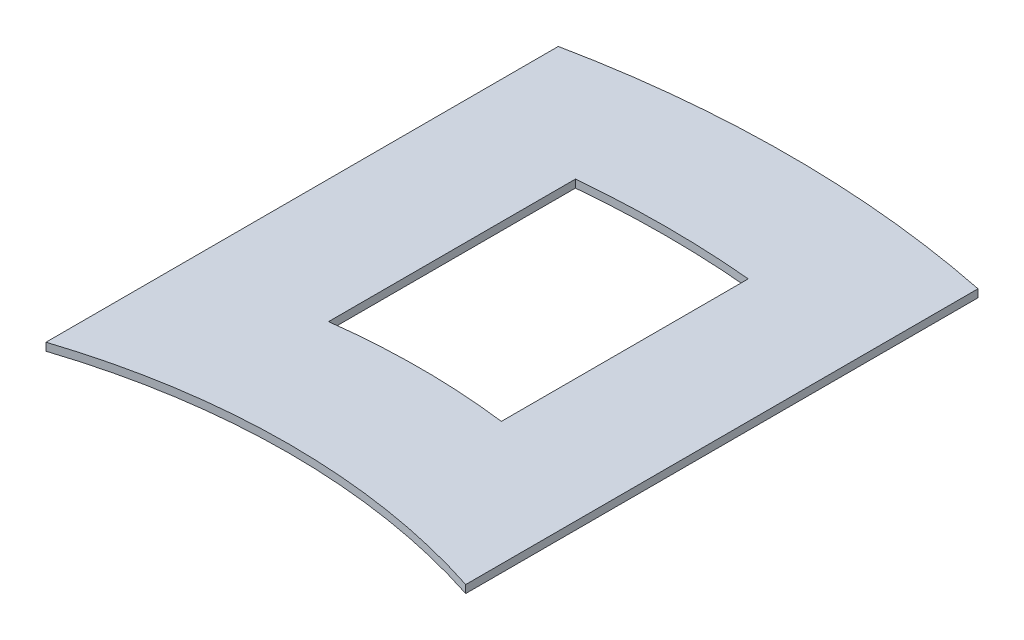
from build123d import *

# Parameters (mm, degrees)
BOSS_EXTRUDE1_DEPTH = 0.127


with BuildPart() as part:
    # Sketch1 → Boss-Extrude1 (new body)
    with BuildSketch(Plane(origin=(0, 0, 0), x_dir=(1, 0, 0), z_dir=(0, 1, 0))):
        with BuildLine():
            Line((-3.4, 5.722006489), (-3.4, -2.577478695))
            ThreePointArc((-3.4, -2.577478695), (0, -2.03883616), (3.4, -2.577478695))
            Line((3.4, -2.577478695), (3.4, 5.722006489))
            ThreePointArc((3.4, 5.722006489), (0, 6.065476238), (-3.4, 5.722006489))
        make_face()
        with BuildLine():
            Line((-1.4, 4), (-1.4, 0))
            ThreePointArc((-1.4, 0), (0, 0.089454642), (1.4, 0))
            Line((1.4, 0), (1.4, 4))
            ThreePointArc((1.4, 4), (0, 4.065476238), (-1.4, 4))
        make_face(mode=Mode.SUBTRACT)
    extrude(amount=BOSS_EXTRUDE1_DEPTH)


solid = part.part
